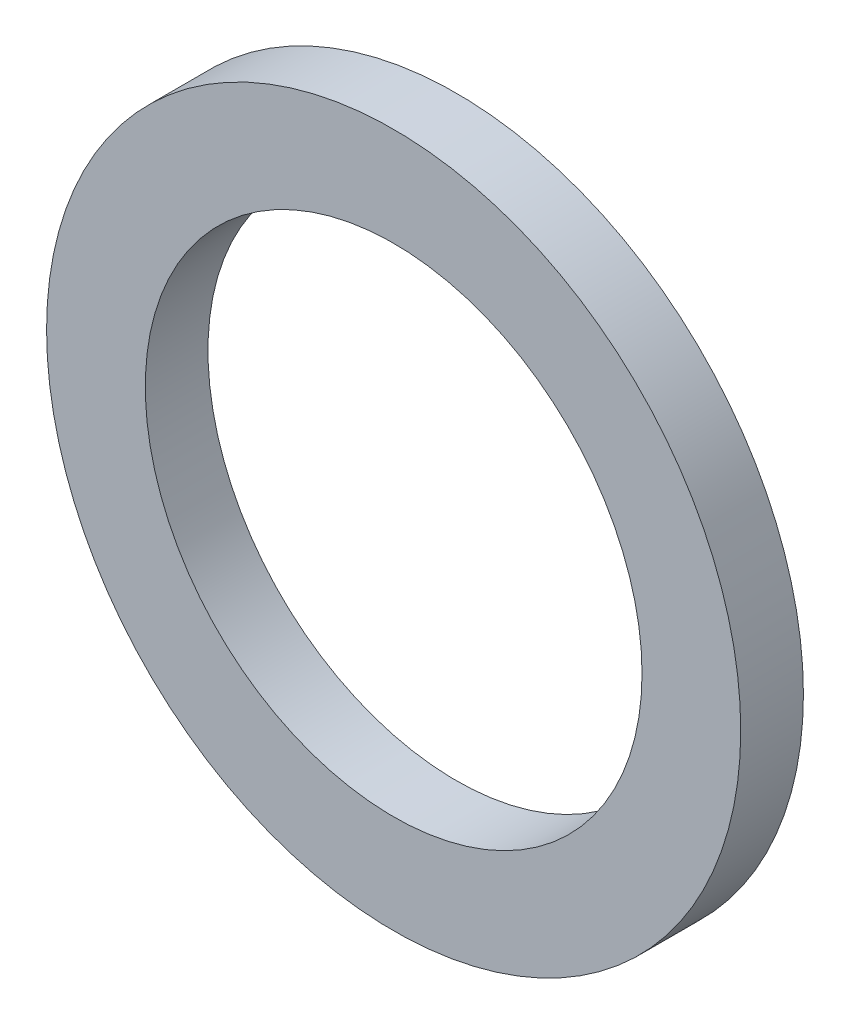
from build123d import *

# Parameters (mm, degrees)
SKETCH1_R           = 22.15
SKETCH1_R_2         = 15.85
BOSS_EXTRUDE1_DEPTH = 4


with BuildPart() as part:
    # Sketch1 → Boss-Extrude1 (new body)
    with BuildSketch(Plane.XY):
        Circle(SKETCH1_R)
        Circle(SKETCH1_R_2, mode=Mode.SUBTRACT)
    extrude(amount=BOSS_EXTRUDE1_DEPTH)


solid = part.part
